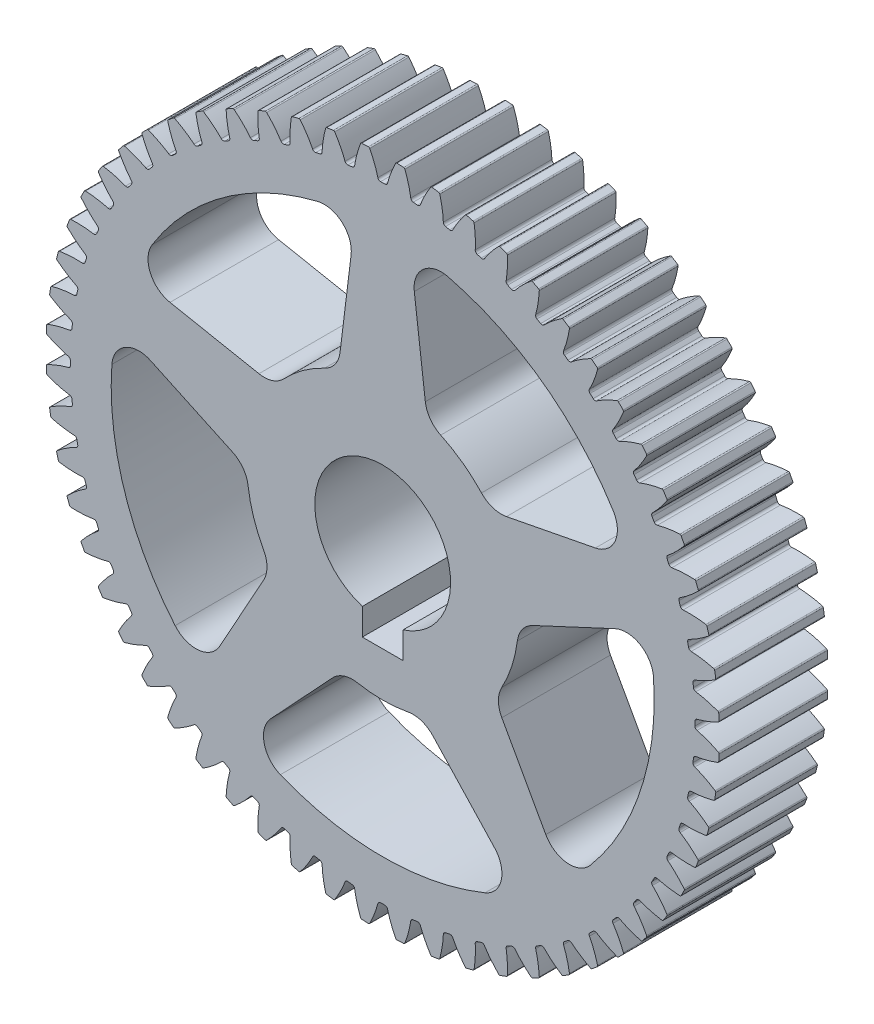
from build123d import *

# Parameters (mm, degrees)
SKETCH1_R                            = 39.37
BOSS_EXTRUDE1_DEPTH                  = 12.7
CUT_EXTRUDE_DCGTBC_DEPTH             = 58.107650976
FILLET_DCGTBC_R                      = 0.16191473
CIRPATTERN_DCGTBC_COUNT              = 60
FILLET_DCGTBC_OF_CIRPATTERN_DCGTBC_R = 0.16191473
SKETCH4_R                            = 4.7625
CUT_EXTRUDE2_DEPTH                   = 58.059181876
SKETCH5_R                            = 7.9375
CUT_EXTRUDE3_DEPTH                   = 58.059181876
SKETCH6_W                            = 4.7625
SKETCH6_H                            = 5.49148
CUT_EXTRUDE4_DEPTH                   = 58.059181876
CUT_EXTRUDE5_DEPTH                   = 58.059181876
FILLET1_R                            = 3.175


with BuildPart() as part:
    # Sketch1 → Boss-Extrude1 (new body)
    with BuildSketch(Plane.XY):
        Circle(SKETCH1_R)
    extrude(amount=BOSS_EXTRUDE1_DEPTH)

    # DCGTBC → Cut-Extrude-DCGTBC (cut, through all)
    with BuildSketch(Plane.XY):
        with BuildLine():
            add(Edge.make_bspline(
                [(0.564673794, 36.757139), (0.569752824, 36.77751056), (0.587706523, 36.848517624), (0.620851797, 36.973683165), (0.672070042, 37.152885261), (0.737239862, 37.363834604), (0.808836317, 37.578651296), (0.883543476, 37.789880551), (0.963928396, 38.003116718), (1.045179017, 38.209304019), (1.134608426, 38.423274879), (1.21971488, 38.620680309), (1.320648819, 38.841622259), (1.403731936, 39.019858567), (1.494221571, 39.203784748), (1.538952316, 39.293274658), (1.562102909, 39.33899763)],
                knots=[0.235927291, 0.235927291, 0.235927291, 0.235927291, 0.235927291, 0.256307345, 0.307035032, 0.361767352, 0.416499661, 0.471231937, 0.525964282, 0.580696616, 0.635428982, 0.690161387, 0.744893688, 0.799626082, 0.854358407, 0.909090914, 0.909090914, 0.909090914, 0.909090914, 0.909090914], degree=4))
            ThreePointArc((1.562102909, 39.33899763), (0, 39.37), (-1.562102909, 39.33899763))
            add(Edge.make_bspline(
                [(-0.564673794, 36.757139), (-0.569752824, 36.77751056), (-0.587706523, 36.848517624), (-0.620851797, 36.973683165), (-0.672070042, 37.152885261), (-0.737239862, 37.363834604), (-0.808836317, 37.578651296), (-0.883543476, 37.789880551), (-0.963928396, 38.003116718), (-1.045179017, 38.209304019), (-1.134608426, 38.423274879), (-1.21971488, 38.620680309), (-1.320648819, 38.841622259), (-1.403731936, 39.019858567), (-1.494221571, 39.203784748), (-1.538952316, 39.293274658), (-1.562102909, 39.33899763)],
                knots=[0.235927291, 0.235927291, 0.235927291, 0.235927291, 0.235927291, 0.256307345, 0.307035032, 0.361767352, 0.416499661, 0.471231937, 0.525964282, 0.580696616, 0.635428982, 0.690161387, 0.744893688, 0.799626082, 0.854358407, 0.909090914, 0.909090914, 0.909090914, 0.909090914, 0.909090914], degree=4))
            ThreePointArc((-0.564673794, 36.757139), (-0.448964478, 36.579621325), (-0.248261007, 36.511655984))
            ThreePointArc((-0.248261007, 36.511655984), (0, 36.5125), (0.248261007, 36.511655984))
            ThreePointArc((0.248261007, 36.511655984), (0.448964478, 36.579621325), (0.564673794, 36.757139))
        make_face()
    cut_extrude_dcgtbc = extrude(amount=CUT_EXTRUDE_DCGTBC_DEPTH, mode=Mode.SUBTRACT)

    # Fillet-DCGTBC
    fillet_dcgtbc_edges = [part.edges().sort_by_distance(p)[0] for p in [
        (1.562102909, 39.33899763, 6.35),
        (-1.562102909, 39.33899763, 6.35),
    ]]
    fillet(fillet_dcgtbc_edges, radius=FILLET_DCGTBC_R)

    # CirPattern-DCGTBC: Cut-Extrude-DCGTBC ×60 about axis
    cirpattern_dcgtbc_axis = Axis((0, 0, 12.7), (0, 0, 1))
    for i in range(1, CIRPATTERN_DCGTBC_COUNT):
        add(cut_extrude_dcgtbc.rotate(cirpattern_dcgtbc_axis, i * 360 / CIRPATTERN_DCGTBC_COUNT), mode=Mode.SUBTRACT)

    # Fillet-DCGTBC of CirPattern-DCGTBC
    fillet_dcgtbc_of_cirpattern_dcgtbc_edges = [part.edges().sort_by_distance(p)[0] for p in [
        (-2.558499423, 39.286778701, 6.35),
        (-5.665590515, 38.960210268, 6.35),
        (-6.6510703, 38.804125604, 6.35),
        (-9.707004725, 38.15456669, 6.35),
        (-10.670770658, 37.896326386, 6.35),
        (-13.64206696, 36.930893694, 6.35),
        (-14.573559821, 36.573327086, 6.35),
        (-17.427663855, 35.302598099, 6.35),
        (-18.316678012, 34.849622761, 6.35),
        (-21.022319617, 33.287519852, 6.35),
        (-21.859114846, 32.744098677, 6.35),
        (-24.386650447, 30.907736571, 6.35),
        (-25.162058644, 30.279823395, 6.35),
        (-27.483796031, 28.189321661, 6.35),
        (-28.189321661, 27.483796031, 6.35),
        (-30.279823395, 25.162058644, 6.35),
        (-30.907736571, 24.386650447, 6.35),
        (-32.744098677, 21.859114846, 6.35),
        (-33.287519852, 21.022319617, 6.35),
        (-34.849622761, 18.316678012, 6.35),
        (-35.302598099, 17.427663855, 6.35),
        (-36.573327086, 14.573559821, 6.35),
        (-36.930893694, 13.64206696, 6.35),
        (-37.896326386, 10.670770658, 6.35),
        (-38.15456669, 9.707004725, 6.35),
        (-38.804125604, 6.6510703, 6.35),
        (-38.960210268, 5.665590515, 6.35),
        (-39.286778701, 2.558499423, 6.35),
        (-39.33899763, 1.562102909, 6.35),
        (-39.33899763, -1.562102909, 6.35),
        (-39.286778701, -2.558499423, 6.35),
        (-38.960210268, -5.665590515, 6.35),
        (-38.804125604, -6.6510703, 6.35),
        (-38.15456669, -9.707004725, 6.35),
        (-37.896326386, -10.670770658, 6.35),
        (-36.930893694, -13.64206696, 6.35),
        (-36.573327086, -14.573559821, 6.35),
        (-35.302598099, -17.427663855, 6.35),
        (-34.849622761, -18.316678012, 6.35),
        (-33.287519852, -21.022319617, 6.35),
        (-32.744098677, -21.859114846, 6.35),
        (-30.907736571, -24.386650447, 6.35),
        (-30.279823395, -25.162058644, 6.35),
        (-28.189321661, -27.483796031, 6.35),
        (-27.483796031, -28.189321661, 6.35),
        (-25.162058644, -30.279823395, 6.35),
        (-24.386650447, -30.907736571, 6.35),
        (-21.859114846, -32.744098677, 6.35),
        (-21.022319617, -33.287519852, 6.35),
        (-18.316678012, -34.849622761, 6.35),
        (-17.427663855, -35.302598099, 6.35),
        (-14.573559821, -36.573327086, 6.35),
        (-13.64206696, -36.930893694, 6.35),
        (-10.670770658, -37.896326386, 6.35),
        (-9.707004725, -38.15456669, 6.35),
        (-6.6510703, -38.804125604, 6.35),
        (-5.665590515, -38.960210268, 6.35),
        (-2.558499423, -39.286778701, 6.35),
        (-1.562102909, -39.33899763, 6.35),
        (1.562102909, -39.33899763, 6.35),
        (2.558499423, -39.286778701, 6.35),
        (5.665590515, -38.960210268, 6.35),
        (6.6510703, -38.804125604, 6.35),
        (9.707004725, -38.15456669, 6.35),
        (10.670770658, -37.896326386, 6.35),
        (13.64206696, -36.930893694, 6.35),
        (14.573559821, -36.573327086, 6.35),
        (17.427663855, -35.302598099, 6.35),
        (18.316678012, -34.849622761, 6.35),
        (21.022319617, -33.287519852, 6.35),
        (21.859114846, -32.744098677, 6.35),
        (24.386650447, -30.907736571, 6.35),
        (25.162058644, -30.279823395, 6.35),
        (27.483796031, -28.189321661, 6.35),
        (28.189321661, -27.483796031, 6.35),
        (30.279823395, -25.162058644, 6.35),
        (30.907736571, -24.386650447, 6.35),
        (32.744098677, -21.859114846, 6.35),
        (33.287519852, -21.022319617, 6.35),
        (34.849622761, -18.316678012, 6.35),
        (35.302598099, -17.427663855, 6.35),
        (36.573327086, -14.573559821, 6.35),
        (36.930893694, -13.64206696, 6.35),
        (37.896326386, -10.670770658, 6.35),
        (38.15456669, -9.707004725, 6.35),
        (38.804125604, -6.6510703, 6.35),
        (38.960210268, -5.665590515, 6.35),
        (39.286778701, -2.558499423, 6.35),
        (39.33899763, -1.562102909, 6.35),
        (39.33899763, 1.562102909, 6.35),
        (39.286778701, 2.558499423, 6.35),
        (38.960210268, 5.665590515, 6.35),
        (38.804125604, 6.6510703, 6.35),
        (38.15456669, 9.707004725, 6.35),
        (37.896326386, 10.670770658, 6.35),
        (36.930893694, 13.64206696, 6.35),
        (36.573327086, 14.573559821, 6.35),
        (35.302598099, 17.427663855, 6.35),
        (34.849622761, 18.316678012, 6.35),
        (33.287519852, 21.022319617, 6.35),
        (32.744098677, 21.859114846, 6.35),
        (30.907736571, 24.386650447, 6.35),
        (30.279823395, 25.162058644, 6.35),
        (28.189321661, 27.483796031, 6.35),
        (27.483796031, 28.189321661, 6.35),
        (25.162058644, 30.279823395, 6.35),
        (24.386650447, 30.907736571, 6.35),
        (21.859114846, 32.744098677, 6.35),
        (21.022319617, 33.287519852, 6.35),
        (18.316678012, 34.849622761, 6.35),
        (17.427663855, 35.302598099, 6.35),
        (14.573559821, 36.573327086, 6.35),
        (13.64206696, 36.930893694, 6.35),
        (10.670770658, 37.896326386, 6.35),
        (9.707004725, 38.15456669, 6.35),
        (6.6510703, 38.804125604, 6.35),
        (5.665590515, 38.960210268, 6.35),
        (2.558499423, 39.286778701, 6.35),
    ]]
    fillet(fillet_dcgtbc_of_cirpattern_dcgtbc_edges, radius=FILLET_DCGTBC_OF_CIRPATTERN_DCGTBC_R)

    # Sketch4 → Cut-Extrude2 (cut, through all)
    with BuildSketch(Plane.XY.offset(12.7)):
        Circle(SKETCH4_R)
    extrude(amount=-CUT_EXTRUDE2_DEPTH, mode=Mode.SUBTRACT)

    # Sketch5 → Cut-Extrude3 (cut, through all)
    with BuildSketch(Plane.XY.offset(12.7)):
        Circle(SKETCH5_R)
    extrude(amount=-CUT_EXTRUDE3_DEPTH, mode=Mode.SUBTRACT)

    # Sketch6 → Cut-Extrude4 (cut, through all)
    with BuildSketch(Plane.XY.offset(12.7)):
        with Locations((0, -7.9375)):
            Rectangle(SKETCH6_W, SKETCH6_H)
    extrude(amount=-CUT_EXTRUDE4_DEPTH, mode=Mode.SUBTRACT)

    # Sketch7 → Cut-Extrude5 (cut, through all)
    with BuildSketch(Plane.XY.offset(12.7)):
        with BuildLine():
            Line((-5.212743334, 14.994763484), (-3.175, 31.590851128))
            ThreePointArc((-3.175, 31.590851128), (-18.66218176, 25.686289571), (-29.063555864, 12.781714305))
            Line((-29.063555864, 12.781714305), (-12.650041244, 9.591250259))
            ThreePointArc((-12.650041244, 9.591250259), (-9.33109088, 12.843144786), (-5.212743334, 14.994763484))
        make_face()
        with BuildLine():
            ThreePointArc((29.063555864, 12.781714305), (18.66218176, 25.686289571), (3.175, 31.590851128))
            Line((3.175, 31.590851128), (5.212743334, 14.994763484))
            ThreePointArc((5.212743334, 14.994763484), (9.33109088, 12.843144786), (12.650041244, 9.591250259))
            Line((12.650041244, 9.591250259), (29.063555864, 12.781714305))
        make_face()
        with BuildLine():
            Line((-15.871693799, -0.323976773), (-31.025813778, 6.742505426))
            ThreePointArc((-31.025813778, 6.742505426), (-30.196044392, -9.811289571), (-21.137265358, -23.691317253))
            Line((-21.137265358, -23.691317253), (-13.030898782, -9.067044829))
            ThreePointArc((-13.030898782, -9.067044829), (-15.098022196, -4.905644786), (-15.871693799, -0.323976773))
        make_face()
        with BuildLine():
            ThreePointArc((21.137265358, -23.691317253), (30.196044392, -9.811289571), (31.025813778, 6.742505426))
            Line((31.025813778, 6.742505426), (15.871693799, -0.323976773))
            ThreePointArc((15.871693799, -0.323976773), (15.098022196, -4.905644786), (13.030898782, -9.067044829))
            Line((13.030898782, -9.067044829), (21.137265358, -23.691317253))
        make_face()
        with BuildLine():
            Line((-4.596502893, -15.194992141), (-16.000007443, -27.423753605))
            ThreePointArc((-16.000007443, -27.423753605), (0, -31.75), (16.000007443, -27.423753605))
            Line((16.000007443, -27.423753605), (4.596502893, -15.194992141))
            ThreePointArc((4.596502893, -15.194992141), (0, -15.875), (-4.596502893, -15.194992141))
        make_face()
    extrude(amount=-CUT_EXTRUDE5_DEPTH, mode=Mode.SUBTRACT)

    # Fillet1
    fillet1_edges = [part.edges().sort_by_distance(p)[0] for p in [
        (-4.596502893, -15.194992141, 6.35),
        (4.596502893, -15.194992141, 6.35),
        (16.000007443, -27.423753605, 6.35),
        (-16.000007443, -27.423753605, 6.35),
        (31.025813778, 6.742505426, 6.35),
        (21.137265358, -23.691317253, 6.35),
        (13.030898782, -9.067044829, 6.35),
        (15.871693799, -0.323976773, 6.35),
        (12.650041244, 9.591250259, 6.35),
        (5.212743334, 14.994763484, 6.35),
        (3.175, 31.590851128, 6.35),
        (29.063555864, 12.781714305, 6.35),
        (-15.871693799, -0.323976773, 6.35),
        (-13.030898782, -9.067044829, 6.35),
        (-31.025813778, 6.742505426, 6.35),
        (-21.137265358, -23.691317253, 6.35),
        (-3.175, 31.590851128, 6.35),
        (-5.212743334, 14.994763484, 6.35),
        (-12.650041244, 9.591250259, 6.35),
        (-29.063555864, 12.781714305, 6.35),
    ]]
    fillet(fillet1_edges, radius=FILLET1_R)


solid = part.part
